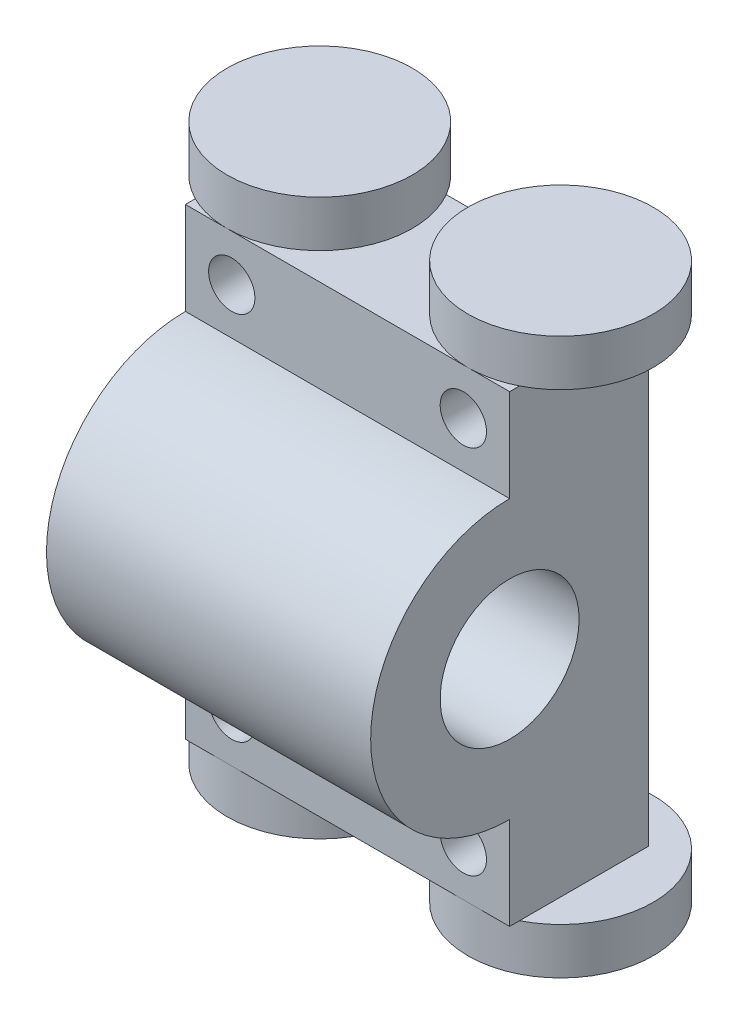
from build123d import *

# Parameters (mm, degrees)
BODY_DEPTH              = 35
SKETCH3_R               = 7.5
SHAFT_HOLE_DEPTH        = 40
SKETCH4_R               = 2.5
BOSS_EXTRUDE1_DEPTH     = 5
SKETCH5_R               = 10
BEARING_DEPTH           = 5
MIRROR5_COPY_1_SKETCH_R = 10
MIRROR5_COPY_1_DEPTH    = 5
SKETCH6_R               = 2.5
CUT_EXTRUDE1_DEPTH      = 55.224072145


with BuildPart() as part:
    # Sketch1 → body (new body)
    with BuildSketch(Plane(origin=(0, 0, 0), x_dir=(0, 0, -1), z_dir=(1, 0, 0))):
        with BuildLine():
            Line((-15, -15), (-15, -25))
            Line((-15, -25), (0, -25))
            Line((0, -25), (0, 25))
            Line((0, 25), (-15, 25))
            Line((-15, 25), (-15, 15))
            ThreePointArc((-15, 15), (-30, 0), (-15, -15))
        make_face()
    extrude(amount=BODY_DEPTH)

    # Sketch3 → shaft hole (cut)
    with BuildSketch(Plane(origin=(35, 0, 0), x_dir=(0, 0, -1), z_dir=(1, 0, 0))):
        with Locations((-15, 0)):
            Circle(SKETCH3_R)
    extrude(amount=-SHAFT_HOLE_DEPTH, mode=Mode.SUBTRACT)

    # Sketch4 → Boss-Extrude1 (add)
    with BuildSketch(Plane(origin=(0, 25, 0), x_dir=(1, 0, 0), z_dir=(0, 1, 0))):
        with Locations((4.5, -5)):
            Circle(SKETCH4_R)
        with Locations((30.5, -5)):
            Circle(SKETCH4_R)
    boss_extrude1 = extrude(amount=BOSS_EXTRUDE1_DEPTH)

    # Mirror1: Boss-Extrude1 across plane
    add(boss_extrude1.mirror(Plane.ZX))

    # Sketch5 → bearing (add)
    with BuildSketch(Plane(origin=(0, 30, 0), x_dir=(1, 0, 0), z_dir=(0, 1, 0))):
        with Locations((4.5, -5)):
            Circle(SKETCH5_R)
    bearing = extrude(amount=-BEARING_DEPTH)

    # Mirror2: bearing across plane
    add(bearing.mirror(Plane.ZX))

    # Mirror5: bearing across plane
    add(bearing.mirror(Plane(origin=(17.5, 0, 0), x_dir=(0, 0, 1), z_dir=(1, 0, 0))))

    # Mirror5 copy 1 sketch → Mirror5 copy 1 (add)
    with BuildSketch(Plane(origin=(35, -30, 0), x_dir=(-1, 0, 0), z_dir=(0, -1, 0))):
        with Locations((4.5, -5)):
            Circle(MIRROR5_COPY_1_SKETCH_R)
    extrude(amount=-MIRROR5_COPY_1_DEPTH)

    # Sketch6 → Cut-Extrude1 (cut, through all)
    with BuildSketch(Plane.XY.offset(15)):
        with Locations((5, 20)):
            Circle(SKETCH6_R)
        with Locations((30, 20)):
            Circle(SKETCH6_R)
        with Locations((30, -20)):
            Circle(SKETCH6_R)
        with Locations((5, -20)):
            Circle(SKETCH6_R)
    extrude(amount=-CUT_EXTRUDE1_DEPTH, mode=Mode.SUBTRACT)


solid = part.part
